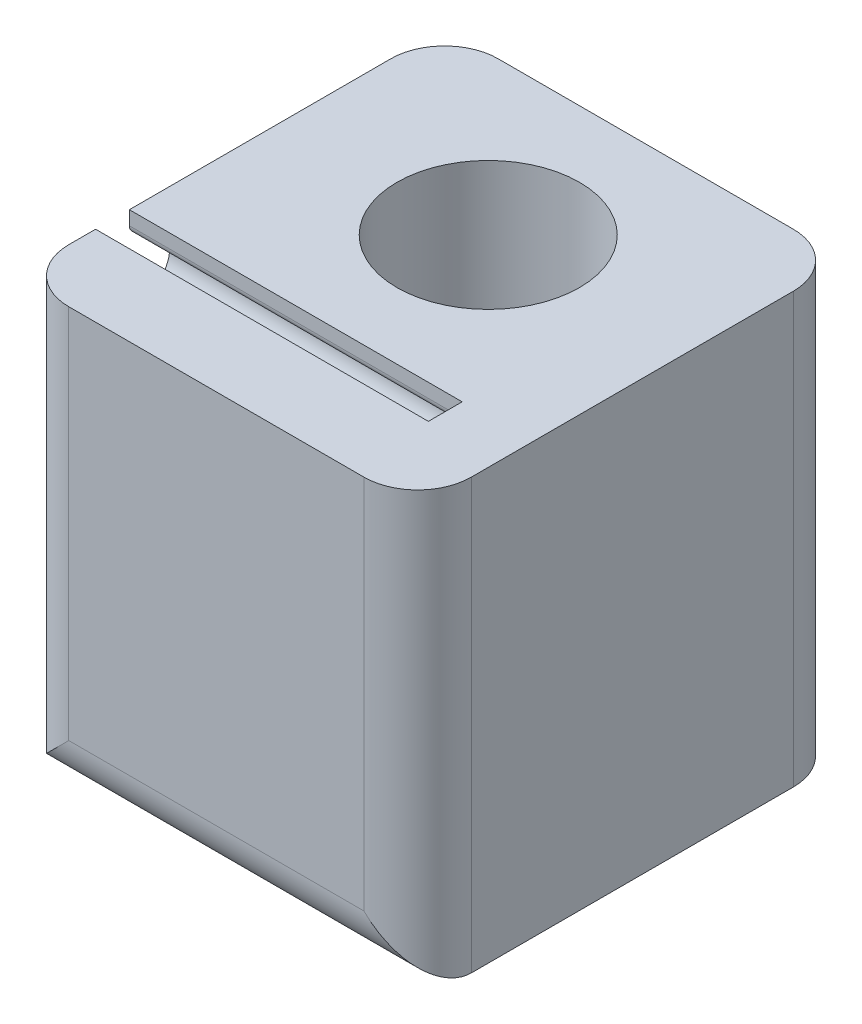
from build123d import *

# Parameters (mm, degrees)
SKETCH1_W            = 8
SKETCH1_H            = 8
BOSS_EXTRUDE1_DEPTH  = 7.5
CUT_EXTRUDE1_DEPTH   = 6.2
M3_CLEARANCE_HOLE1_D = 3.4
FILLET1_R            = 1


with BuildPart() as part:
    # Sketch1 → Boss-Extrude1 (new body)
    with BuildSketch(Plane(origin=(0, 0, 0), x_dir=(0, 0, -1), z_dir=(1, 0, 0))):
        Rectangle(SKETCH1_W, SKETCH1_H)
    extrude(amount=BOSS_EXTRUDE1_DEPTH)

    # Sketch2 → Cut-Extrude1 (cut)
    with BuildSketch(Plane(origin=(0, 0, 0), x_dir=(0, 0, -1), z_dir=(1, 0, 0))):
        with BuildLine():
            Line((-1.87, 4), (-1.87, 3.740175425))
            ThreePointArc((-1.87, 3.740175425), (-1.832771412, 3.641268354), (-1.739565217, 3.591456891))
            ThreePointArc((-1.739565217, 3.591456891), (-1.581937846, 3.557611714), (-1.431797753, 3.498876404))
            ThreePointArc((-1.431797753, 3.498876404), (-1.12, 3), (-1.431797753, 2.501123596))
            ThreePointArc((-1.431797753, 2.501123596), (-1.581937846, 2.442388286), (-1.739565217, 2.408543109))
            ThreePointArc((-1.739565217, 2.408543109), (-1.832771412, 2.358731646), (-1.87, 2.259824575))
            Line((-1.87, 2.259824575), (-1.87, 2))
            Line((-1.87, 2), (-1.87, 1.740175425))
            ThreePointArc((-1.87, 1.740175425), (-1.832771412, 1.641268354), (-1.739565217, 1.591456891))
            ThreePointArc((-1.739565217, 1.591456891), (-1.581937846, 1.557611714), (-1.431797753, 1.498876404))
            ThreePointArc((-1.431797753, 1.498876404), (-1.12, 1), (-1.431797753, 0.501123596))
            ThreePointArc((-1.431797753, 0.501123596), (-1.581937846, 0.442388286), (-1.739565217, 0.408543109))
            ThreePointArc((-1.739565217, 0.408543109), (-1.832771412, 0.358731646), (-1.87, 0.259824575))
            Line((-1.87, 0.259824575), (-1.87, 0))
            Line((-1.87, 0), (-1.87, -0.259824575))
            ThreePointArc((-1.87, -0.259824575), (-1.832771412, -0.358731646), (-1.739565217, -0.408543109))
            ThreePointArc((-1.739565217, -0.408543109), (-1.581937846, -0.442388286), (-1.431797753, -0.501123596))
            ThreePointArc((-1.431797753, -0.501123596), (-1.12, -1), (-1.431797753, -1.498876404))
            ThreePointArc((-1.431797753, -1.498876404), (-1.581937846, -1.557611714), (-1.739565217, -1.591456891))
            ThreePointArc((-1.739565217, -1.591456891), (-1.832771412, -1.641268354), (-1.87, -1.740175425))
            Line((-1.87, -1.740175425), (-1.87, -2))
            Line((-1.87, -2), (-1.87, -2.259824575))
            ThreePointArc((-1.87, -2.259824575), (-1.832771412, -2.358731646), (-1.739565217, -2.408543109))
            ThreePointArc((-1.739565217, -2.408543109), (-1.581937846, -2.442388286), (-1.431797753, -2.501123596))
            ThreePointArc((-1.431797753, -2.501123596), (-1.12, -3), (-1.431797753, -3.498876404))
            ThreePointArc((-1.431797753, -3.498876404), (-1.581937846, -3.557611714), (-1.739565217, -3.591456891))
            ThreePointArc((-1.739565217, -3.591456891), (-1.832771412, -3.641268354), (-1.87, -3.740175425))
            Line((-1.87, -3.740175425), (-1.87, -4))
            Line((-1.87, -4), (-2.5, -4))
            Line((-2.5, -4), (-2.5, 4))
            Line((-2.5, 4), (-1.87, 4))
        make_face()
    extrude(amount=CUT_EXTRUDE1_DEPTH, mode=Mode.SUBTRACT)

    # M3 Clearance Hole1 (through all)
    with Locations(Plane(origin=(0, 4, 0), x_dir=(1, 0, 0), z_dir=(0, 1, 0))):
        with Locations((3.75, 1.065)):
            Hole(M3_CLEARANCE_HOLE1_D / 2)

    # Fillet1
    fillet1_edges = [part.edges().sort_by_distance(p)[0] for p in [
        (3.75, -4, 4),
        (7.5, 0, 4),
        (7.5, 0, -4),
        (0, 0, -4),
        (0, 0, 4),
    ]]
    fillet(fillet1_edges, radius=FILLET1_R)


solid = part.part
